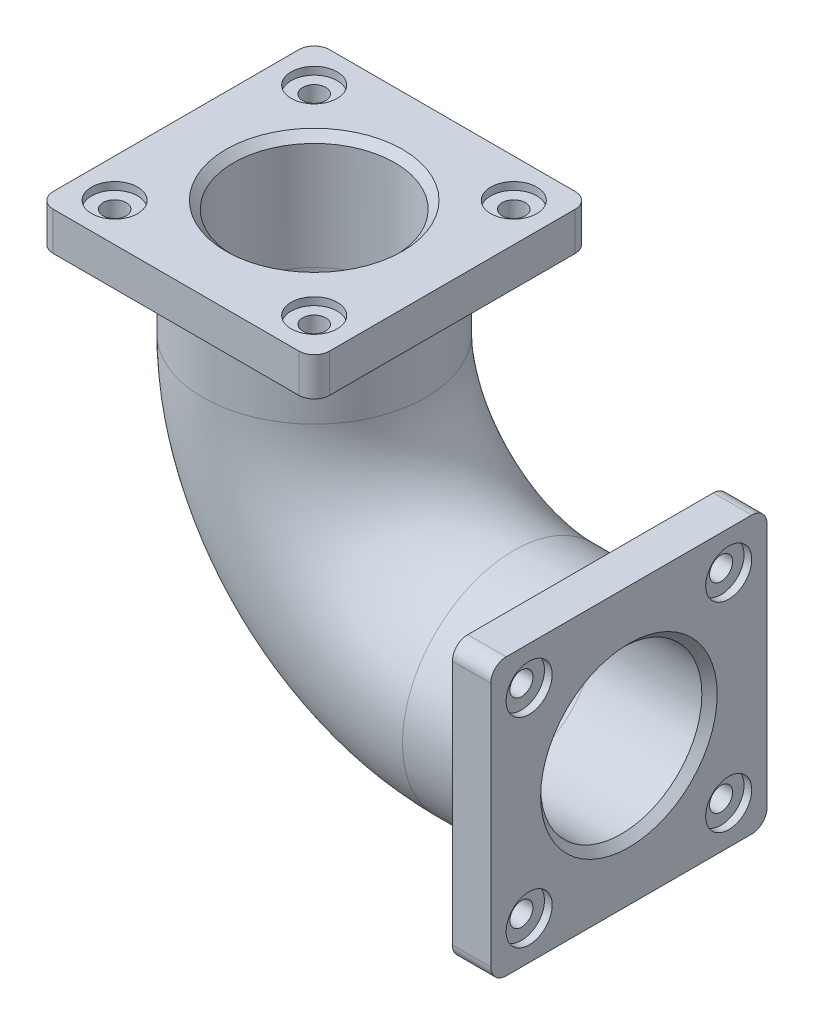
from build123d import *

# Parameters (mm, degrees)
SKETCH1_W           = 360
SKETCH1_H           = 360
SKETCH1_R           = 105
SKETCH1_R_2         = 15
BOSS_EXTRUDE1_DEPTH = 50
SKETCH2_R           = 30
CUT_EXTRUDE1_DEPTH  = 10
CHAMFER1_SIZE       = 10
SKETCH3_R           = 145
BOSS_EXTRUDE2_DEPTH = 100
SKETCH5_R           = 105
CUT_EXTRUDE2_DEPTH  = 100
FILLET1_R           = 10
FILLET2_R           = 20
SWEEP4_OUTLINE_R    = 145
SWEEP4_OUTLINE_R_2  = 105
SWEEP4_ANGLE        = 45


# Read off the part's stored shape, not the designer's step: Sweep4
with BuildPart() as part:
    # Sketch1 → Boss-Extrude1 (new body)
    with BuildSketch(Plane(origin=(0, 0, 0), x_dir=(1, 0, 0), z_dir=(0, 1, 0))):
        Rectangle(SKETCH1_W, SKETCH1_H)
        with Locations(Location((0, 0, 0), (0, 0, 270))):
            Circle(SKETCH1_R, mode=Mode.SUBTRACT)
        with Locations(Location((-130, -130, 0), (0, 0, 270))):
            Circle(SKETCH1_R_2, mode=Mode.SUBTRACT)
        with Locations(Location((130, -130, 0), (0, 0, 90))):
            Circle(SKETCH1_R_2, mode=Mode.SUBTRACT)
        with Locations(Location((130, 130, 0), (0, 0, 270))):
            Circle(SKETCH1_R_2, mode=Mode.SUBTRACT)
        with Locations(Location((-130, 130, 0), (0, 0, 90))):
            Circle(SKETCH1_R_2, mode=Mode.SUBTRACT)
    extrude(amount=-BOSS_EXTRUDE1_DEPTH)

    # Sketch2 → Cut-Extrude1 (cut)
    with BuildSketch(Plane(origin=(0, 0, 0), x_dir=(1, 0, 0), z_dir=(0, 1, 0))):
        with Locations(Location((-130, -130, 0), (0, 0, 270))):
            Circle(SKETCH2_R)
        with Locations(Location((130, -130, 0), (0, 0, 90))):
            Circle(SKETCH2_R)
        with Locations(Location((130, 130, 0), (0, 0, 270))):
            Circle(SKETCH2_R)
        with Locations(Location((-130, 130, 0), (0, 0, 90))):
            Circle(SKETCH2_R)
    extrude(amount=-CUT_EXTRUDE1_DEPTH, mode=Mode.SUBTRACT)

    # Chamfer1
    chamfer1_edges = [part.edges().sort_by_distance(p)[0] for p in [
        (0, 0, -105),
    ]]
    chamfer(chamfer1_edges, length=CHAMFER1_SIZE)

    # Sketch3 → Boss-Extrude2 (add)
    with BuildSketch(Plane.XZ.offset(50)):
        with Locations(Location((0, 0, 0), (0, 0, 270))):
            Circle(SKETCH3_R)
    extrude(amount=BOSS_EXTRUDE2_DEPTH)

    # Sketch5 → Cut-Extrude2 (cut)
    with BuildSketch(Plane(origin=(0, -50, 0), x_dir=(1, 0, 0), z_dir=(0, 1, 0))):
        with Locations(Location((0, 0, 0), (0, 0, 270))):
            Circle(SKETCH5_R)
    extrude(amount=-CUT_EXTRUDE2_DEPTH, mode=Mode.SUBTRACT)

    # Fillet1
    fillet1_edges = [part.edges().sort_by_distance(p)[0] for p in [
        (0, -50, 145),
    ]]
    fillet(fillet1_edges, radius=FILLET1_R)

    # Fillet2
    fillet2_edges = [part.edges().sort_by_distance(p)[0] for p in [
        (180, -25, 180),
        (-180, -25, 180),
        (-180, -25, -180),
        (180, -25, -180),
    ]]
    fillet(fillet2_edges, radius=FILLET2_R)

    # Sweep4 outline → Sweep4 (revolve)
    with BuildSketch(Plane(origin=(260, -150, 0), x_dir=(-1, 0, 0), z_dir=(0, 1, 0))):
        with Locations((260, 0)):
            Circle(SWEEP4_OUTLINE_R)
        with Locations((260, 0)):
            Circle(SWEEP4_OUTLINE_R_2, mode=Mode.SUBTRACT)
    revolve(axis=Axis((260, -150, 0), (0, 0, 1)), revolution_arc=SWEEP4_ANGLE)

    # Mirror2: part across plane


with BuildPart() as part_1:
    add(part.part)
    add(part.part.mirror(Plane(origin=(76.152236891, -333.847763109, 0), x_dir=(0, 0, 1), z_dir=(0.7071067811865438, -0.7071067811865512, 0))))


solid = part_1.part
